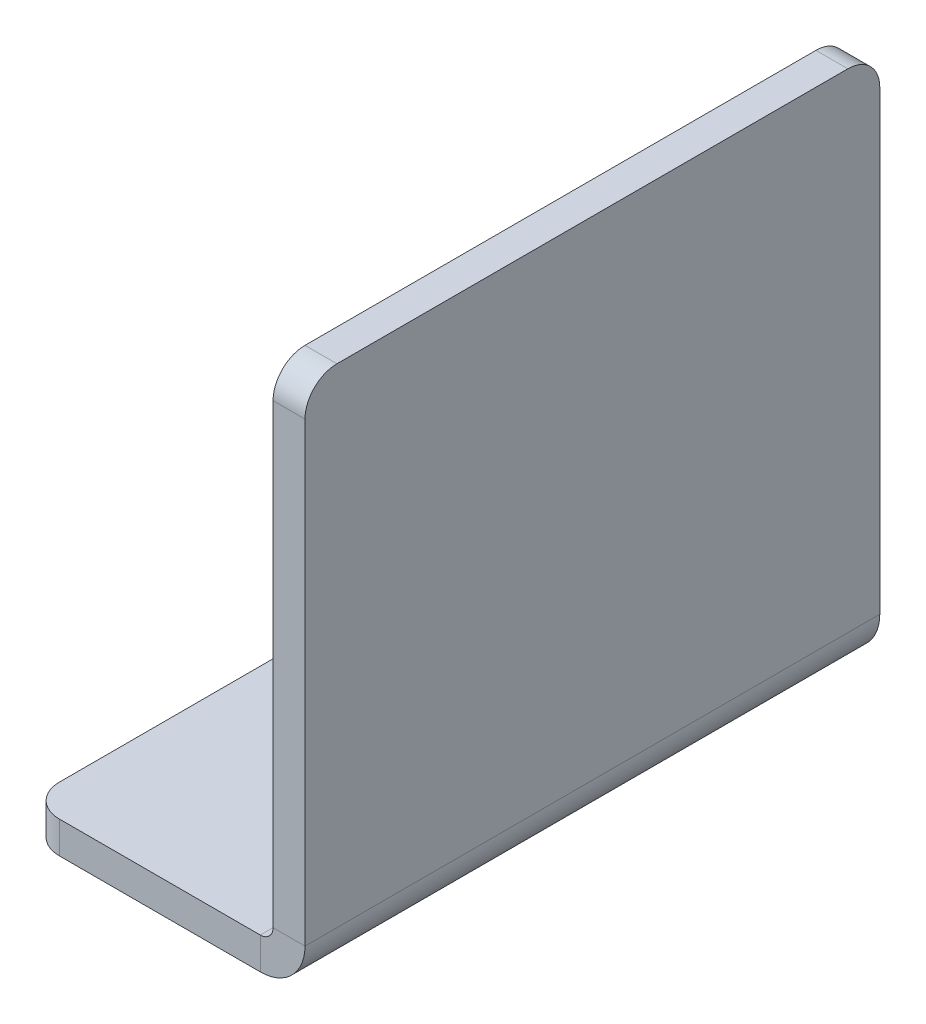
from build123d import *

# Parameters (mm, degrees)
SKETCH11_W             = 152.4
SKETCH11_H             = 114.3
BOSS_EXTRUDE1_DEPTH    = 6.35
SKETCHED_START         = -114.3
SKETCHED_BEND1_DEPTH   = 114.3
SKETCHED_BEND1_2_DEPTH = 114.3
FILLET1_R              = 6.35


# Read off the part's stored shape, not the designer's step: Sketched Bend1
with BuildPart() as part:
    # Sketch11 → Boss-Extrude1 (new body)
    with BuildSketch(Plane(origin=(0, 0, 0), x_dir=(1, 0, 0), z_dir=(0, 1, 0))):
        with Locations((76.2, 57.15)):
            Rectangle(SKETCH11_W, SKETCH11_H)
    extrude(amount=BOSS_EXTRUDE1_DEPTH)

    # Sketched Bend1 outline → Sketched Bend1 (cut)
    with BuildSketch(Plane.XY.offset(SKETCHED_START)):
        with BuildLine():
            Line((152.4, 6.35), (54.83086849, 6.35))
            ThreePointArc((54.83086849, 6.35), (51.624240665, 1.762142678), (46.311449496, 0))
            Line((46.311449496, 0), (152.4, 0))
            Line((152.4, 0), (152.4, 6.35))
        make_face()
    extrude(amount=SKETCHED_BEND1_DEPTH, mode=Mode.SUBTRACT)

    # Sketched Bend1 2 outline → Sketched Bend1 2 (add)
    with BuildSketch(Plane.XY.offset(SKETCHED_START)):
        with BuildLine():
            Line((48.851449496, 106.001449496), (48.851449496, 8.89))
            ThreePointArc((48.851449496, 8.89), (48.10750072, 7.093948776), (46.311449496, 6.35))
            Line((46.311449496, 6.35), (54.83086849, 6.35))
            ThreePointArc((54.83086849, 6.35), (55.108316406, 7.606554415), (55.201449496, 8.89))
            Line((55.201449496, 8.89), (55.201449496, 106.001449496))
            Line((55.201449496, 106.001449496), (48.851449496, 106.001449496))
        make_face()
    extrude(amount=SKETCHED_BEND1_2_DEPTH)

    # Fillet1
    fillet1_edges = [part.edges().sort_by_distance(p)[0] for p in [
        (0, 3.175, 0),
        (0, 3.175, -114.3),
        (52.026449496, 106.001449496, -114.3),
        (52.026449496, 106.001449496, 0),
    ]]
    fillet(fillet1_edges, radius=FILLET1_R)


solid = part.part
